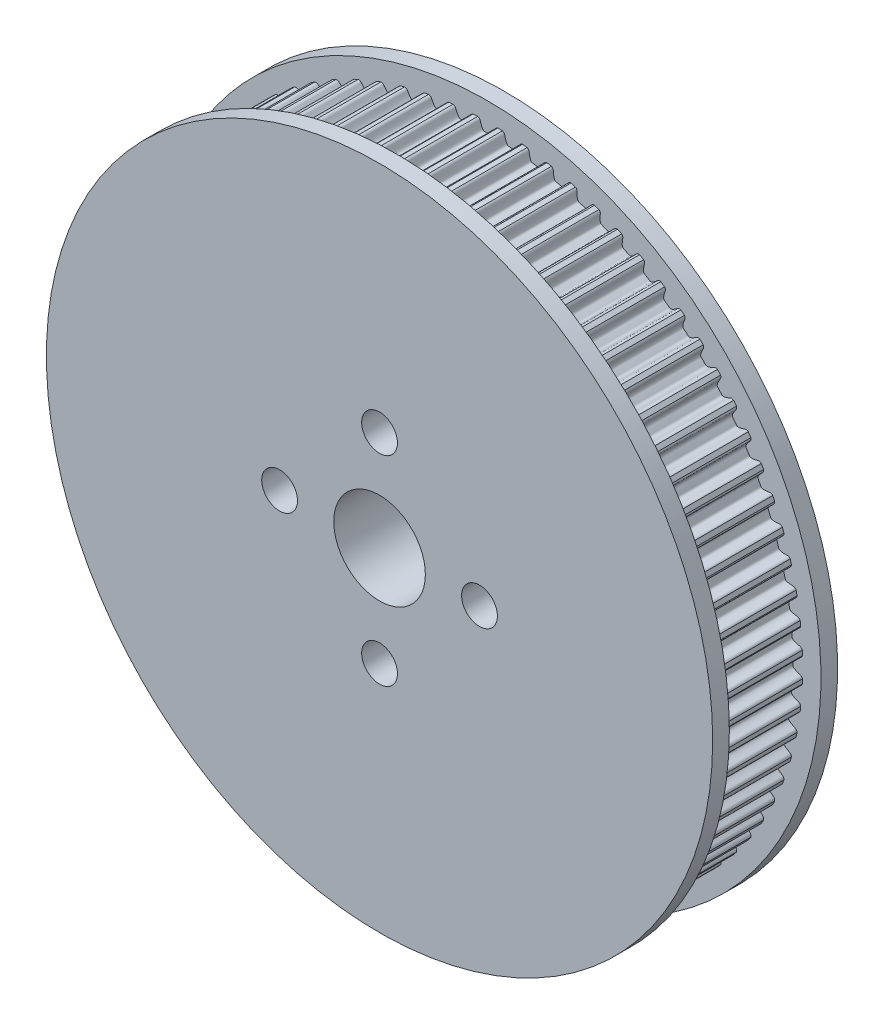
from build123d import *

# Parameters (mm, degrees)
TOOTHEXTRUDECUTGEARBELT01_DEPTH = 8.249999876
TOOTH_PATTERN_80_COUNT          = 80
BOREREVOLVESKETCH_W             = 19.547999706
BOREREVOLVESKETCH_H             = 5
SKETCH_5_R                      = 51.143599003
CUT_EXTRUDE_2_DEPTH             = 4.55
SKETCH_6_R                      = 46.559266738
CUT_EXTRUDE_3_DEPTH             = 4
SKETCH_7_R                      = 40
EXTRUDE_1_DEPTH                 = 2
EXTRUDE_START                   = 2
SKETCH_8_R                      = 40
EXTRUDE_2_DEPTH                 = 2
SKETCH_9_R                      = 5.5
SKETCH_9_R_2                    = 2.15
CUT_EXTRUDE_4_DEPTH             = 59.522987032
SKETCH_10_R                     = 16.5
CUT_EXTRUDE_5_DEPTH             = 2


with BuildPart() as part:
    # SketchRevolveGearBelt01 → Gates_PowerGrip_GT_3mm, 15mm Belt Width (revolve)
    with BuildSketch(Plane(origin=(0, 0, 0), x_dir=(0, 0, -1), z_dir=(1, 0, 0))):
        Polygon((9.773999853, 0), (9.773999853, 35.797185804), (9.011999865, 35.797185804), (9.011999865, 38.045614547), (9.480047286, 39.175580978), (8.776051092, 39.467185749), (8.249999876, 38.197185768), (8.249999876, 37.802215774), (-8.249999876, 37.802215774), (-8.249999876, 38.197185768), (-8.776051092, 39.467185749), (-9.480047286, 39.175580978), (-9.011999865, 38.045614547), (-9.011999865, 35.797185804), (-9.773999853, 35.797185804), (-9.773999853, 0), align=None)
    revolve(axis=Axis((0, 0, 0), (0, 0, -1)))

    # SketchToothGearBelt01 → ToothExtrudeCutGearBelt01 (cut, symmetric)
    with BuildSketch(Plane.XY):
        with BuildLine():
            ThreePointArc((37.793573234, 1.290479747), (37.815598842, 0), (37.793573234, -1.290479747))
            add(Edge.make_bspline(
                [(37.793573234, -1.290479747), (37.79307472, -1.264976376), (37.788644264, -1.226795868), (37.775571082, -1.177423162), (37.762274769, -1.141499281), (37.745608084, -1.107009575), (37.725723572, -1.074269272), (37.702802887, -1.043578055), (37.677056009, -1.015215252), (37.648716801, -0.989444938), (37.618050085, -0.966484967), (37.585314888, -0.946611534), (37.550890193, -0.929758993), (37.485124269, -0.90652126), (37.402687659, -0.881674599), (37.30635265, -0.851218998), (37.227679648, -0.824734015), (37.153760478, -0.798276453), (37.084604612, -0.771815968), (37.020208101, -0.745360213), (36.96056983, -0.718907349), (36.905687385, -0.692457579), (36.855557906, -0.666010094), (36.810177651, -0.639563429), (36.769542079, -0.613114736), (36.733645452, -0.586658928), (36.702482818, -0.560187301), (36.676046841, -0.533685798), (36.65434721, -0.507133275), (36.637366146, -0.480502635), (36.625237397, -0.453766913), (36.61767629, -0.426922601), (36.61437444, -0.375466934), (36.619147816, -0.299989788), (36.619363897, -0.19995905), (36.62051669, -0.099984782), (36.620687797, 0), (36.62051669, 0.099984782), (36.619363897, 0.19995905), (36.619147816, 0.299989788), (36.61437444, 0.375466934), (36.61767629, 0.426922601), (36.625237397, 0.453766913), (36.637366146, 0.480502635), (36.65434721, 0.507133275), (36.676046841, 0.533685798), (36.702482818, 0.560187301), (36.733645452, 0.586658928), (36.769542079, 0.613114736), (36.810177651, 0.639563429), (36.855557906, 0.666010094), (36.905687385, 0.692457579), (36.96056983, 0.718907349), (37.020208101, 0.745360213), (37.084604612, 0.771815968), (37.153760478, 0.798276453), (37.227679648, 0.824734015), (37.30635265, 0.851218998), (37.402687659, 0.881674599), (37.485124269, 0.90652126), (37.550890193, 0.929758993), (37.585314888, 0.946611534), (37.618050085, 0.966484967), (37.648716801, 0.989444938), (37.677056009, 1.015215252), (37.702802887, 1.043578055), (37.725723572, 1.074269272), (37.745608084, 1.107009575), (37.762274769, 1.141499281), (37.775571082, 1.177423162), (37.788644264, 1.226795868), (37.79307472, 1.264976376), (37.793573234, 1.290479747)],
                knots=[0, 0, 0, 0, 0.019344771, 0.029017156, 0.038689541, 0.048361927, 0.058034312, 0.067706697, 0.077379082, 0.087051468, 0.096723853, 0.106396238, 0.116068624, 0.125741009, 0.159263433, 0.181398553, 0.202387924, 0.222238624, 0.240959024, 0.258559107, 0.275050891, 0.290448988, 0.30477136, 0.318040336, 0.33028401, 0.34153816, 0.351848865, 0.361276054, 0.369898094, 0.377817295, 0.38516538, 0.392106664, 0.398835331, 0.424145229, 0.449430153, 0.474715076, 0.5, 0.525284924, 0.550569847, 0.575854771, 0.601164669, 0.607893336, 0.61483462, 0.622182705, 0.630101906, 0.638723946, 0.648151135, 0.65846184, 0.66971599, 0.681959664, 0.69522864, 0.709551012, 0.724949109, 0.741440893, 0.759040976, 0.777761376, 0.797612076, 0.818601447, 0.840736567, 0.874258991, 0.883931376, 0.893603762, 0.903276147, 0.912948532, 0.922620918, 0.932293303, 0.941965688, 0.951638073, 0.961310459, 0.970982844, 0.980655229, 1, 1, 1, 1], degree=3))
        make_face()
    toothextrudecutgearbelt01 = extrude(amount=TOOTHEXTRUDECUTGEARBELT01_DEPTH, both=True, mode=Mode.SUBTRACT)

    # Tooth Pattern, 80: ToothExtrudeCutGearBelt01 ×80 about axis
    tooth_pattern_80_axis = Axis((0, 0, 55), (0, 0, -1))
    for i in range(1, TOOTH_PATTERN_80_COUNT):
        add(toothextrudecutgearbelt01.rotate(tooth_pattern_80_axis, i * 360 / TOOTH_PATTERN_80_COUNT), mode=Mode.SUBTRACT)

    # BoreRevolveSketch → BoreRevolveCut (revolve, cut)
    with BuildSketch(Plane(origin=(0, 0, 0), x_dir=(0, 0, -1), z_dir=(1, 0, 0))):
        with Locations((0, 2.5)):
            Rectangle(BOREREVOLVESKETCH_W, BOREREVOLVESKETCH_H)
    revolve(axis=Axis((0, 0, 0), (0, 0, -1)), mode=Mode.SUBTRACT)

    # 草图5 → 切除-拉伸2 (cut)
    with BuildSketch(Plane.XY.offset(9.773999853)):
        Circle(SKETCH_5_R)
    extrude(amount=-CUT_EXTRUDE_2_DEPTH, mode=Mode.SUBTRACT)

    # 草图6 → 切除-拉伸3 (cut)
    with BuildSketch(Plane(origin=(0, 0, -9.773999853), x_dir=(-1, 0, 0), z_dir=(0, 0, -1))):
        Circle(SKETCH_6_R)
    extrude(amount=-CUT_EXTRUDE_3_DEPTH, mode=Mode.SUBTRACT)

    # 草图7 → 凸台-拉伸1 (add)
    with BuildSketch(Plane(origin=(0, 0, -5.773999853), x_dir=(-1, 0, 0), z_dir=(0, 0, -1))):
        Circle(SKETCH_7_R)
    extrude(amount=EXTRUDE_1_DEPTH)

    # 草图8 → 凸台-拉伸2 (add)
    with BuildSketch(Plane.XY.offset(5.223999853).offset(EXTRUDE_START)):
        Circle(SKETCH_8_R)
    extrude(amount=-EXTRUDE_2_DEPTH)

    # 草图9 → 切除-拉伸4 (cut, through all)
    with BuildSketch(Plane.XY.offset(7.223999853)):
        Circle(SKETCH_9_R)
        with Locations((0, 12)):
            Circle(SKETCH_9_R_2)
        with Locations((12, 0)):
            Circle(SKETCH_9_R_2)
        with Locations((0, -12)):
            Circle(SKETCH_9_R_2)
        with Locations((-12, 0)):
            Circle(SKETCH_9_R_2)
    extrude(amount=-CUT_EXTRUDE_4_DEPTH, mode=Mode.SUBTRACT)

    # 草图10 → 切除-拉伸5 (cut)
    with BuildSketch(Plane(origin=(0, 0, -7.773999853), x_dir=(-1, 0, 0), z_dir=(0, 0, -1))):
        Circle(SKETCH_10_R)
    extrude(amount=-CUT_EXTRUDE_5_DEPTH, mode=Mode.SUBTRACT)


solid = part.part
